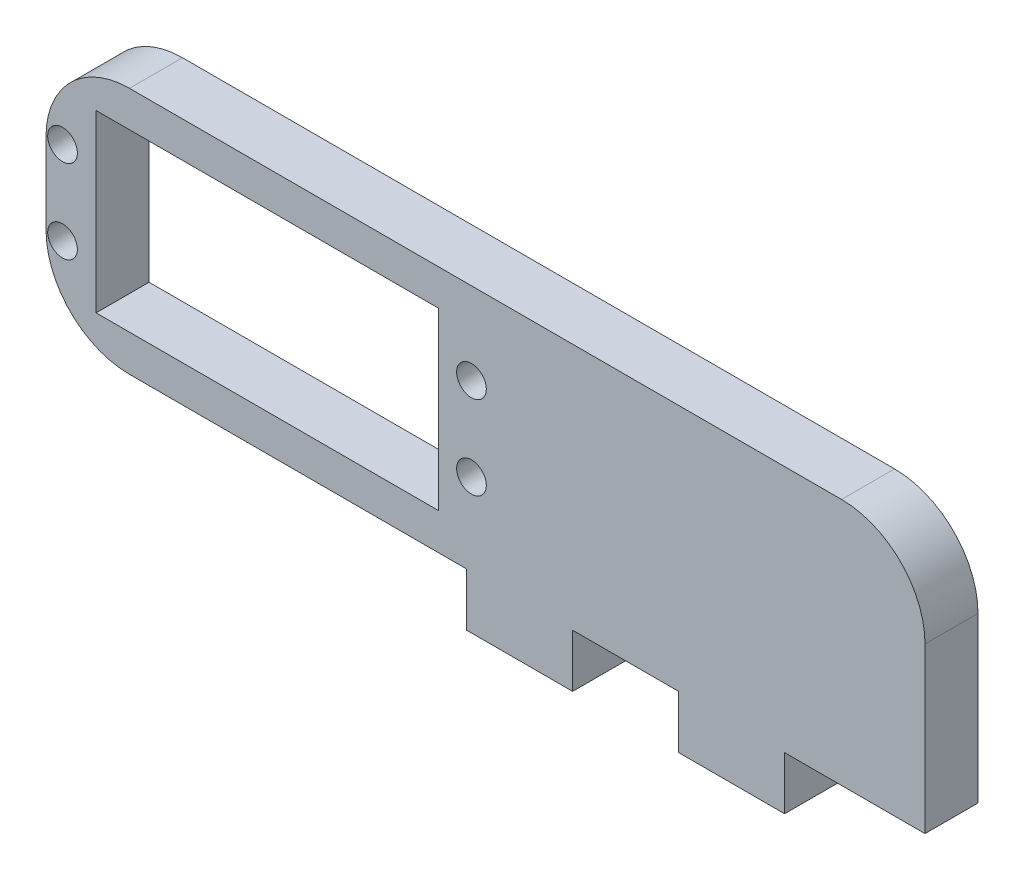
from build123d import *

# Parameters (mm, degrees)
BOSS_EXTRUDE1_DEPTH = 6.35
SKETCH3_R           = 1.778
SKETCH3_W           = 41
SKETCH3_H           = 21
CUT_EXTRUDE1_DEPTH  = 102.778507746
FILLET1_R           = 10


with BuildPart() as part:
    # Sketch1 → Boss-Extrude1 (new body)
    with BuildSketch(Plane.XY):
        Polygon((19.05, 38.1), (19.05, 44.45), (35.872396717, 44.45), (35.872396717, 74.129883576), (-49.45, 74.129883576), (-69.45, 74.129883576), (-69.45, 44.45), (-44.45, 44.45), (-19.05, 44.45), (-19.05, 38.1), (-6.35, 38.1), (-6.35, 44.45), (6.35, 44.45), (6.35, 38.1), align=None)
    extrude(amount=BOSS_EXTRUDE1_DEPTH)

    # Sketch3 → Cut-Extrude1 (cut, through all)
    with BuildSketch(Plane.XY.offset(6.35)):
        with Locations((-67.4705, 64.289941788)):
            Circle(SKETCH3_R)
        with Locations((-67.4705, 54.289941788)):
            Circle(SKETCH3_R)
        with Locations((-18.4705, 54.289941788)):
            Circle(SKETCH3_R)
        with Locations((-18.4705, 64.289941788)):
            Circle(SKETCH3_R)
        with Locations((-42.95, 59.329883576)):
            Rectangle(SKETCH3_W, SKETCH3_H)
    extrude(amount=-CUT_EXTRUDE1_DEPTH, mode=Mode.SUBTRACT)

    # Fillet1
    fillet1_edges = [part.edges().sort_by_distance(p)[0] for p in [
        (-69.45, 74.129883576, 3.175),
        (35.872396717, 74.129883576, 3.175),
        (-69.45, 44.45, 3.175),
    ]]
    fillet(fillet1_edges, radius=FILLET1_R)


solid = part.part
